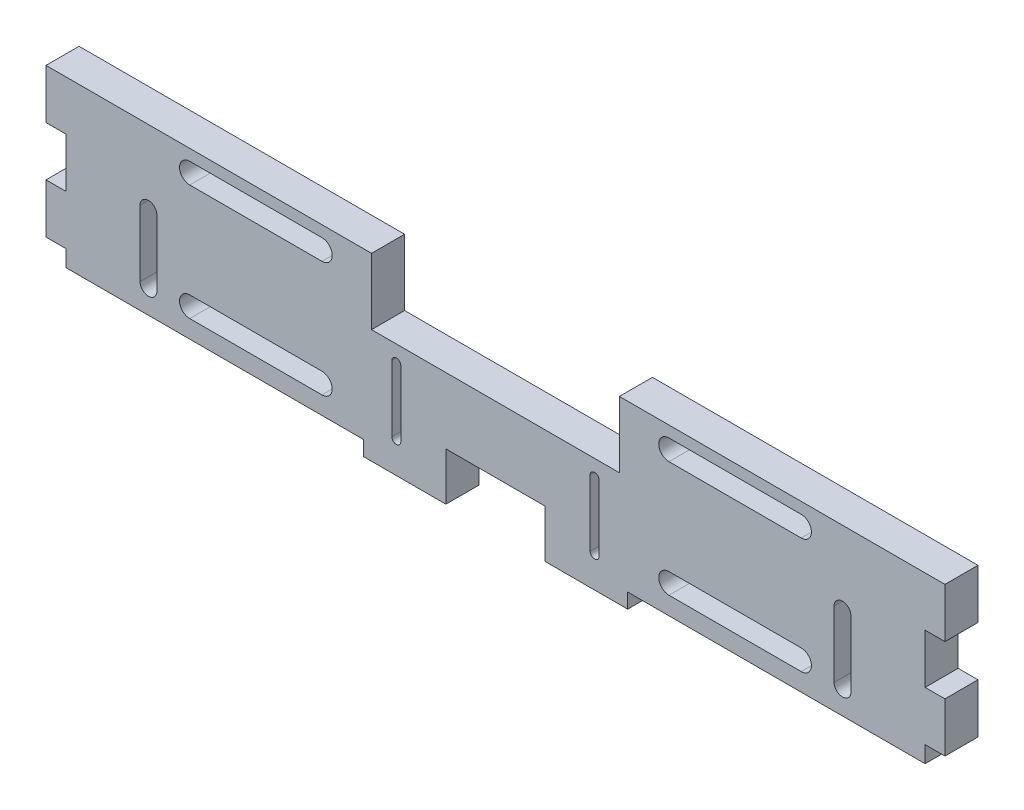
from build123d import *

# Parameters (mm, degrees)
EXTRUDE_1_DEPTH     = 10
CUT_EXTRUDE_1_DEPTH = 140.112364655
SKETCH_3_W          = 30
SKETCH_3_H          = 10
SKETCH_3_W_2        = 75
SKETCH_3_H_2        = 20
CUT_EXTRUDE_2_DEPTH = 140.112364655
SKETCH_4_W          = 25
SKETCH_4_H          = 10
EXTRUDE_2_DEPTH     = 4.5


with BuildPart() as part:
    # 草圖1 → 填料-伸長1 (new body)
    with BuildSketch(Plane.XY):
        Polygon((136, -22.5), (136, -7.5), (130, -7.5), (130, 7.5), (136, 7.5), (136, 22.5), (-136, 22.5), (-136, 7.5), (-130, 7.5), (-130, -7.5), (-136, -7.5), (-136, -22.5), (-130, -22.5), (-130, -27.5), (130, -27.5), (130, -22.5), align=None)
        with BuildLine():
            Line((-31.35, -22.5), (-31.35, -2.5))
            ThreePointArc((-31.35, -2.5), (-30, -1.15), (-28.65, -2.5))
            Line((-28.65, -2.5), (-28.65, -22.5))
            ThreePointArc((-28.65, -22.5), (-30, -23.85), (-31.35, -22.5))
        make_face(mode=Mode.SUBTRACT)
        with BuildLine():
            Line((31.35, -22.5), (31.35, -2.5))
            ThreePointArc((31.35, -2.5), (30, -1.15), (28.65, -2.5))
            Line((28.65, -2.5), (28.65, -22.5))
            ThreePointArc((28.65, -22.5), (30, -23.85), (31.35, -22.5))
        make_face(mode=Mode.SUBTRACT)
    extrude(amount=EXTRUDE_1_DEPTH)

    # 草圖2 → 除料-伸長1 (cut, through all)
    with BuildSketch(Plane.XY.offset(10)):
        with BuildLine():
            Line((-92.5, 19.1), (-52.5, 19.1))
            ThreePointArc((-52.5, 19.1), (-49.4, 16), (-52.5, 12.9))
            Line((-52.5, 12.9), (-92.5, 12.9))
            ThreePointArc((-92.5, 12.9), (-95.6, 16), (-92.5, 19.1))
        make_face()
        with BuildLine():
            Line((-92.5, -15.9), (-52.5, -15.9))
            ThreePointArc((-52.5, -15.9), (-49.4, -19), (-52.5, -22.1))
            Line((-52.5, -22.1), (-92.5, -22.1))
            ThreePointArc((-92.5, -22.1), (-95.6, -19), (-92.5, -15.9))
        make_face()
        with BuildLine():
            Line((52.5, 19.1), (92.5, 19.1))
            ThreePointArc((92.5, 19.1), (95.6, 16), (92.5, 12.9))
            Line((92.5, 12.9), (52.5, 12.9))
            ThreePointArc((52.5, 12.9), (49.4, 16), (52.5, 19.1))
        make_face()
        with BuildLine():
            Line((52.5, -15.9), (92.5, -15.9))
            ThreePointArc((92.5, -15.9), (95.6, -19), (92.5, -22.1))
            Line((92.5, -22.1), (52.5, -22.1))
            ThreePointArc((52.5, -22.1), (49.4, -19), (52.5, -15.9))
        make_face()
    extrude(amount=-CUT_EXTRUDE_1_DEPTH, mode=Mode.SUBTRACT)

    # 草圖3 → 除料-伸長2 (cut, through all)
    with BuildSketch(Plane.XY.offset(10)):
        with Locations((0, -22.5)):
            Rectangle(SKETCH_3_W, SKETCH_3_H)
        with Locations((0, 12.5)):
            Rectangle(SKETCH_3_W_2, SKETCH_3_H_2)
        with BuildLine():
            Line((-102.45, 0.05), (-102.45, -19.95))
            ThreePointArc((-102.45, -19.95), (-105, -22.5), (-107.55, -19.95))
            Line((-107.55, -19.95), (-107.55, 0.05))
            ThreePointArc((-107.55, 0.05), (-105, 2.6), (-102.45, 0.05))
        make_face()
        with BuildLine():
            Line((102.45, 0.05), (102.45, -19.95))
            ThreePointArc((102.45, -19.95), (105, -22.5), (107.55, -19.95))
            Line((107.55, -19.95), (107.55, 0.05))
            ThreePointArc((107.55, 0.05), (105, 2.6), (102.45, 0.05))
        make_face()
    extrude(amount=-CUT_EXTRUDE_2_DEPTH, mode=Mode.SUBTRACT)

    # 草圖4 → 填料-伸長2 (add)
    with BuildSketch(Plane.XZ.offset(27.5)):
        with Locations((-27.5, 5)):
            Rectangle(SKETCH_4_W, SKETCH_4_H)
        with Locations((27.5, 5)):
            Rectangle(SKETCH_4_W, SKETCH_4_H)
    extrude(amount=EXTRUDE_2_DEPTH)


solid = part.part
